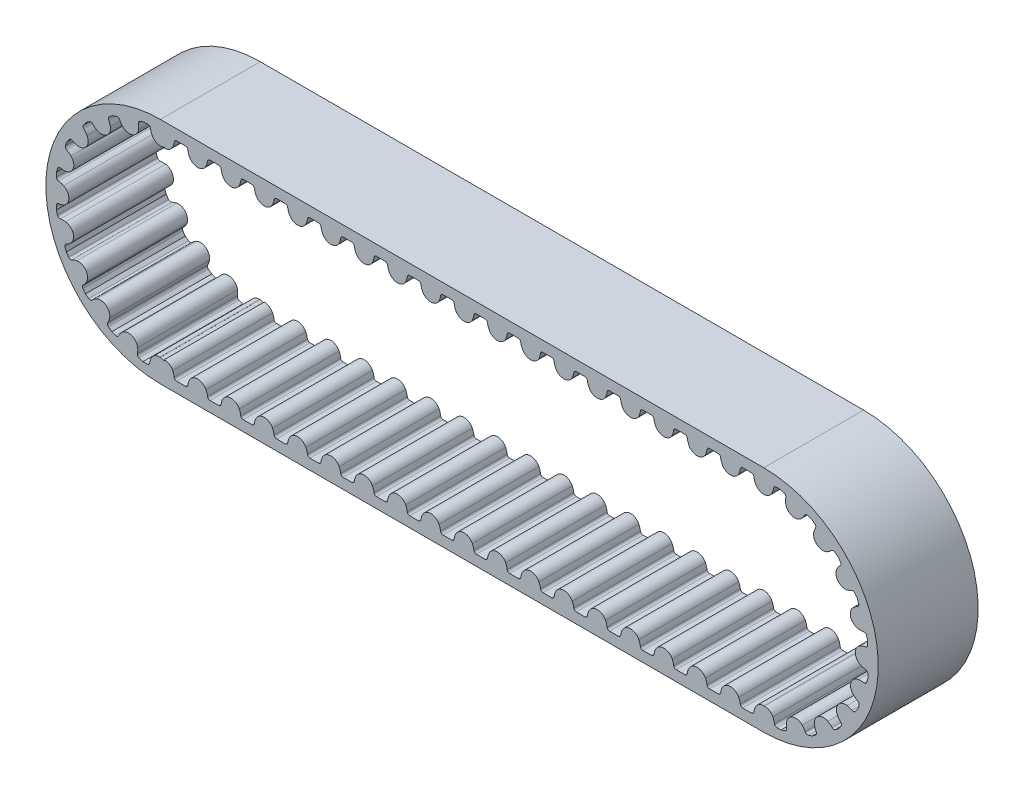
from build123d import *

# Parameters (mm, degrees)
EXTRUDE_THIN1_DEPTH   = 6
BOSS_EXTRUDE1_DEPTH   = 6
LPATTERN1_COUNT       = 18
LPATTERN1_PITCH       = 2
MIRROR1_COPY_1_DEPTH  = 6
MIRROR1_COPY_2_DEPTH  = 6
MIRROR1_COPY_3_DEPTH  = 6
MIRROR1_COPY_4_DEPTH  = 6
MIRROR1_COPY_5_DEPTH  = 6
MIRROR1_COPY_6_DEPTH  = 6
MIRROR1_COPY_7_DEPTH  = 6
MIRROR1_COPY_8_DEPTH  = 6
MIRROR1_COPY_9_DEPTH  = 6
MIRROR1_COPY_10_DEPTH = 6
MIRROR1_COPY_11_DEPTH = 6
MIRROR1_COPY_12_DEPTH = 6
MIRROR1_COPY_13_DEPTH = 6
MIRROR1_COPY_14_DEPTH = 6
MIRROR1_COPY_15_DEPTH = 6
MIRROR1_COPY_16_DEPTH = 6
MIRROR1_COPY_17_DEPTH = 6
BOSS_EXTRUDE2_DEPTH   = 6
MIRROR2_START         = 6
MIRROR2_DEPTH         = 6
CUT_EXTRUDE1_DEPTH    = 29.577285889
SKETCH5_W             = 6
SKETCH5_H             = 13.76
CUT_EXTRUDE2_DEPTH    = 30
BOSS_EXTRUDE3_START   = -6
BOSS_EXTRUDE3_DEPTH   = 6


# Read off the part's stored shape, not the designer's step: Boss-Extrude2, Mirror2
with BuildPart() as part:
    # Sketch1 → Extrude-Thin1 (new body)
    with BuildSketch(Plane.XY):
        with BuildLine():
            Line((18.12, -6.88), (-18.12, -6.88))
            ThreePointArc((-18.12, -6.88), (-25, 0), (-18.12, 6.88))
            Line((-18.12, 6.88), (18.12, 6.88))
            ThreePointArc((18.12, 6.88), (25, 0), (18.12, -6.88))
        make_face()
        with BuildLine():
            Line((18.12, -5.5), (-18.12, -5.5))
            ThreePointArc((-18.12, -5.5), (-23.62, 0), (-18.12, 5.5))
            Line((-18.12, 5.5), (18.12, 5.5))
            ThreePointArc((18.12, 5.5), (23.62, 0), (18.12, -5.5))
        make_face(mode=Mode.SUBTRACT)
    extrude(amount=EXTRUDE_THIN1_DEPTH)

    # Sketch2 → Boss-Extrude1 (add)
    with BuildSketch(Plane.XY.offset(6)):
        with BuildLine():
            Line((17.379824575, 6.25), (16.860175425, 6.25))
            ThreePointArc((16.860175425, 6.25), (16.761268354, 6.212771412), (16.711456891, 6.119565217))
            ThreePointArc((16.711456891, 6.119565217), (16.677611714, 5.961937846), (16.618876404, 5.811797753))
            ThreePointArc((16.618876404, 5.811797753), (16.414149412, 5.584360941), (16.12, 5.5))
            Line((16.12, 5.5), (16.12, 6.88))
            Line((16.12, 6.88), (18.12, 6.88))
            Line((18.12, 6.88), (18.12, 5.5))
            ThreePointArc((18.12, 5.5), (17.825850588, 5.584360941), (17.621123596, 5.811797753))
            ThreePointArc((17.621123596, 5.811797753), (17.562388286, 5.961937846), (17.528543109, 6.119565217))
            ThreePointArc((17.528543109, 6.119565217), (17.478731646, 6.212771412), (17.379824575, 6.25))
        make_face()
    boss_extrude1 = extrude(amount=BOSS_EXTRUDE1_DEPTH)

    # LPattern1: Boss-Extrude1 ×18
    with Locations(*[(-i * LPATTERN1_PITCH, 0, 0) for i in range(1, LPATTERN1_COUNT)]):
        add(boss_extrude1)

    # Mirror1: Boss-Extrude1 across plane
    add(boss_extrude1.mirror(Plane.ZX))

    # Mirror1 copy 1 sketch → Mirror1 copy 1 (add)
    with BuildSketch(Plane(origin=(-2, 0, 6), x_dir=(1, 0, 0), z_dir=(0, 0, 1))):
        with BuildLine():
            Line((17.379824575, -6.25), (16.860175425, -6.25))
            ThreePointArc((16.860175425, -6.25), (16.761268354, -6.212771412), (16.711456891, -6.119565217))
            ThreePointArc((16.711456891, -6.119565217), (16.677611714, -5.961937846), (16.618876404, -5.811797753))
            ThreePointArc((16.618876404, -5.811797753), (16.414149412, -5.584360941), (16.12, -5.5))
            Line((16.12, -5.5), (16.12, -6.88))
            Line((16.12, -6.88), (18.12, -6.88))
            Line((18.12, -6.88), (18.12, -5.5))
            ThreePointArc((18.12, -5.5), (17.825850588, -5.584360941), (17.621123596, -5.811797753))
            ThreePointArc((17.621123596, -5.811797753), (17.562388286, -5.961937846), (17.528543109, -6.119565217))
            ThreePointArc((17.528543109, -6.119565217), (17.478731646, -6.212771412), (17.379824575, -6.25))
        make_face()
    extrude(amount=MIRROR1_COPY_1_DEPTH)

    # Mirror1 copy 2 sketch → Mirror1 copy 2 (add)
    with BuildSketch(Plane(origin=(-4, 0, 6), x_dir=(1, 0, 0), z_dir=(0, 0, 1))):
        with BuildLine():
            Line((17.379824575, -6.25), (16.860175425, -6.25))
            ThreePointArc((16.860175425, -6.25), (16.761268354, -6.212771412), (16.711456891, -6.119565217))
            ThreePointArc((16.711456891, -6.119565217), (16.677611714, -5.961937846), (16.618876404, -5.811797753))
            ThreePointArc((16.618876404, -5.811797753), (16.414149412, -5.584360941), (16.12, -5.5))
            Line((16.12, -5.5), (16.12, -6.88))
            Line((16.12, -6.88), (18.12, -6.88))
            Line((18.12, -6.88), (18.12, -5.5))
            ThreePointArc((18.12, -5.5), (17.825850588, -5.584360941), (17.621123596, -5.811797753))
            ThreePointArc((17.621123596, -5.811797753), (17.562388286, -5.961937846), (17.528543109, -6.119565217))
            ThreePointArc((17.528543109, -6.119565217), (17.478731646, -6.212771412), (17.379824575, -6.25))
        make_face()
    extrude(amount=MIRROR1_COPY_2_DEPTH)

    # Mirror1 copy 3 sketch → Mirror1 copy 3 (add)
    with BuildSketch(Plane(origin=(-6, 0, 6), x_dir=(1, 0, 0), z_dir=(0, 0, 1))):
        with BuildLine():
            Line((17.379824575, -6.25), (16.860175425, -6.25))
            ThreePointArc((16.860175425, -6.25), (16.761268354, -6.212771412), (16.711456891, -6.119565217))
            ThreePointArc((16.711456891, -6.119565217), (16.677611714, -5.961937846), (16.618876404, -5.811797753))
            ThreePointArc((16.618876404, -5.811797753), (16.414149412, -5.584360941), (16.12, -5.5))
            Line((16.12, -5.5), (16.12, -6.88))
            Line((16.12, -6.88), (18.12, -6.88))
            Line((18.12, -6.88), (18.12, -5.5))
            ThreePointArc((18.12, -5.5), (17.825850588, -5.584360941), (17.621123596, -5.811797753))
            ThreePointArc((17.621123596, -5.811797753), (17.562388286, -5.961937846), (17.528543109, -6.119565217))
            ThreePointArc((17.528543109, -6.119565217), (17.478731646, -6.212771412), (17.379824575, -6.25))
        make_face()
    extrude(amount=MIRROR1_COPY_3_DEPTH)

    # Mirror1 copy 4 sketch → Mirror1 copy 4 (add)
    with BuildSketch(Plane(origin=(-8, 0, 6), x_dir=(1, 0, 0), z_dir=(0, 0, 1))):
        with BuildLine():
            Line((17.379824575, -6.25), (16.860175425, -6.25))
            ThreePointArc((16.860175425, -6.25), (16.761268354, -6.212771412), (16.711456891, -6.119565217))
            ThreePointArc((16.711456891, -6.119565217), (16.677611714, -5.961937846), (16.618876404, -5.811797753))
            ThreePointArc((16.618876404, -5.811797753), (16.414149412, -5.584360941), (16.12, -5.5))
            Line((16.12, -5.5), (16.12, -6.88))
            Line((16.12, -6.88), (18.12, -6.88))
            Line((18.12, -6.88), (18.12, -5.5))
            ThreePointArc((18.12, -5.5), (17.825850588, -5.584360941), (17.621123596, -5.811797753))
            ThreePointArc((17.621123596, -5.811797753), (17.562388286, -5.961937846), (17.528543109, -6.119565217))
            ThreePointArc((17.528543109, -6.119565217), (17.478731646, -6.212771412), (17.379824575, -6.25))
        make_face()
    extrude(amount=MIRROR1_COPY_4_DEPTH)

    # Mirror1 copy 5 sketch → Mirror1 copy 5 (add)
    with BuildSketch(Plane(origin=(-10, 0, 6), x_dir=(1, 0, 0), z_dir=(0, 0, 1))):
        with BuildLine():
            Line((17.379824575, -6.25), (16.860175425, -6.25))
            ThreePointArc((16.860175425, -6.25), (16.761268354, -6.212771412), (16.711456891, -6.119565217))
            ThreePointArc((16.711456891, -6.119565217), (16.677611714, -5.961937846), (16.618876404, -5.811797753))
            ThreePointArc((16.618876404, -5.811797753), (16.414149412, -5.584360941), (16.12, -5.5))
            Line((16.12, -5.5), (16.12, -6.88))
            Line((16.12, -6.88), (18.12, -6.88))
            Line((18.12, -6.88), (18.12, -5.5))
            ThreePointArc((18.12, -5.5), (17.825850588, -5.584360941), (17.621123596, -5.811797753))
            ThreePointArc((17.621123596, -5.811797753), (17.562388286, -5.961937846), (17.528543109, -6.119565217))
            ThreePointArc((17.528543109, -6.119565217), (17.478731646, -6.212771412), (17.379824575, -6.25))
        make_face()
    extrude(amount=MIRROR1_COPY_5_DEPTH)

    # Mirror1 copy 6 sketch → Mirror1 copy 6 (add)
    with BuildSketch(Plane(origin=(-12, 0, 6), x_dir=(1, 0, 0), z_dir=(0, 0, 1))):
        with BuildLine():
            Line((17.379824575, -6.25), (16.860175425, -6.25))
            ThreePointArc((16.860175425, -6.25), (16.761268354, -6.212771412), (16.711456891, -6.119565217))
            ThreePointArc((16.711456891, -6.119565217), (16.677611714, -5.961937846), (16.618876404, -5.811797753))
            ThreePointArc((16.618876404, -5.811797753), (16.414149412, -5.584360941), (16.12, -5.5))
            Line((16.12, -5.5), (16.12, -6.88))
            Line((16.12, -6.88), (18.12, -6.88))
            Line((18.12, -6.88), (18.12, -5.5))
            ThreePointArc((18.12, -5.5), (17.825850588, -5.584360941), (17.621123596, -5.811797753))
            ThreePointArc((17.621123596, -5.811797753), (17.562388286, -5.961937846), (17.528543109, -6.119565217))
            ThreePointArc((17.528543109, -6.119565217), (17.478731646, -6.212771412), (17.379824575, -6.25))
        make_face()
    extrude(amount=MIRROR1_COPY_6_DEPTH)

    # Mirror1 copy 7 sketch → Mirror1 copy 7 (add)
    with BuildSketch(Plane(origin=(-14, 0, 6), x_dir=(1, 0, 0), z_dir=(0, 0, 1))):
        with BuildLine():
            Line((17.379824575, -6.25), (16.860175425, -6.25))
            ThreePointArc((16.860175425, -6.25), (16.761268354, -6.212771412), (16.711456891, -6.119565217))
            ThreePointArc((16.711456891, -6.119565217), (16.677611714, -5.961937846), (16.618876404, -5.811797753))
            ThreePointArc((16.618876404, -5.811797753), (16.414149412, -5.584360941), (16.12, -5.5))
            Line((16.12, -5.5), (16.12, -6.88))
            Line((16.12, -6.88), (18.12, -6.88))
            Line((18.12, -6.88), (18.12, -5.5))
            ThreePointArc((18.12, -5.5), (17.825850588, -5.584360941), (17.621123596, -5.811797753))
            ThreePointArc((17.621123596, -5.811797753), (17.562388286, -5.961937846), (17.528543109, -6.119565217))
            ThreePointArc((17.528543109, -6.119565217), (17.478731646, -6.212771412), (17.379824575, -6.25))
        make_face()
    extrude(amount=MIRROR1_COPY_7_DEPTH)

    # Mirror1 copy 8 sketch → Mirror1 copy 8 (add)
    with BuildSketch(Plane(origin=(-16, 0, 6), x_dir=(1, 0, 0), z_dir=(0, 0, 1))):
        with BuildLine():
            Line((17.379824575, -6.25), (16.860175425, -6.25))
            ThreePointArc((16.860175425, -6.25), (16.761268354, -6.212771412), (16.711456891, -6.119565217))
            ThreePointArc((16.711456891, -6.119565217), (16.677611714, -5.961937846), (16.618876404, -5.811797753))
            ThreePointArc((16.618876404, -5.811797753), (16.414149412, -5.584360941), (16.12, -5.5))
            Line((16.12, -5.5), (16.12, -6.88))
            Line((16.12, -6.88), (18.12, -6.88))
            Line((18.12, -6.88), (18.12, -5.5))
            ThreePointArc((18.12, -5.5), (17.825850588, -5.584360941), (17.621123596, -5.811797753))
            ThreePointArc((17.621123596, -5.811797753), (17.562388286, -5.961937846), (17.528543109, -6.119565217))
            ThreePointArc((17.528543109, -6.119565217), (17.478731646, -6.212771412), (17.379824575, -6.25))
        make_face()
    extrude(amount=MIRROR1_COPY_8_DEPTH)

    # Mirror1 copy 9 sketch → Mirror1 copy 9 (add)
    with BuildSketch(Plane(origin=(-18, 0, 6), x_dir=(1, 0, 0), z_dir=(0, 0, 1))):
        with BuildLine():
            Line((17.379824575, -6.25), (16.860175425, -6.25))
            ThreePointArc((16.860175425, -6.25), (16.761268354, -6.212771412), (16.711456891, -6.119565217))
            ThreePointArc((16.711456891, -6.119565217), (16.677611714, -5.961937846), (16.618876404, -5.811797753))
            ThreePointArc((16.618876404, -5.811797753), (16.414149412, -5.584360941), (16.12, -5.5))
            Line((16.12, -5.5), (16.12, -6.88))
            Line((16.12, -6.88), (18.12, -6.88))
            Line((18.12, -6.88), (18.12, -5.5))
            ThreePointArc((18.12, -5.5), (17.825850588, -5.584360941), (17.621123596, -5.811797753))
            ThreePointArc((17.621123596, -5.811797753), (17.562388286, -5.961937846), (17.528543109, -6.119565217))
            ThreePointArc((17.528543109, -6.119565217), (17.478731646, -6.212771412), (17.379824575, -6.25))
        make_face()
    extrude(amount=MIRROR1_COPY_9_DEPTH)

    # Mirror1 copy 10 sketch → Mirror1 copy 10 (add)
    with BuildSketch(Plane(origin=(-20, 0, 6), x_dir=(1, 0, 0), z_dir=(0, 0, 1))):
        with BuildLine():
            Line((17.379824575, -6.25), (16.860175425, -6.25))
            ThreePointArc((16.860175425, -6.25), (16.761268354, -6.212771412), (16.711456891, -6.119565217))
            ThreePointArc((16.711456891, -6.119565217), (16.677611714, -5.961937846), (16.618876404, -5.811797753))
            ThreePointArc((16.618876404, -5.811797753), (16.414149412, -5.584360941), (16.12, -5.5))
            Line((16.12, -5.5), (16.12, -6.88))
            Line((16.12, -6.88), (18.12, -6.88))
            Line((18.12, -6.88), (18.12, -5.5))
            ThreePointArc((18.12, -5.5), (17.825850588, -5.584360941), (17.621123596, -5.811797753))
            ThreePointArc((17.621123596, -5.811797753), (17.562388286, -5.961937846), (17.528543109, -6.119565217))
            ThreePointArc((17.528543109, -6.119565217), (17.478731646, -6.212771412), (17.379824575, -6.25))
        make_face()
    extrude(amount=MIRROR1_COPY_10_DEPTH)

    # Mirror1 copy 11 sketch → Mirror1 copy 11 (add)
    with BuildSketch(Plane(origin=(-22, 0, 6), x_dir=(1, 0, 0), z_dir=(0, 0, 1))):
        with BuildLine():
            Line((17.379824575, -6.25), (16.860175425, -6.25))
            ThreePointArc((16.860175425, -6.25), (16.761268354, -6.212771412), (16.711456891, -6.119565217))
            ThreePointArc((16.711456891, -6.119565217), (16.677611714, -5.961937846), (16.618876404, -5.811797753))
            ThreePointArc((16.618876404, -5.811797753), (16.414149412, -5.584360941), (16.12, -5.5))
            Line((16.12, -5.5), (16.12, -6.88))
            Line((16.12, -6.88), (18.12, -6.88))
            Line((18.12, -6.88), (18.12, -5.5))
            ThreePointArc((18.12, -5.5), (17.825850588, -5.584360941), (17.621123596, -5.811797753))
            ThreePointArc((17.621123596, -5.811797753), (17.562388286, -5.961937846), (17.528543109, -6.119565217))
            ThreePointArc((17.528543109, -6.119565217), (17.478731646, -6.212771412), (17.379824575, -6.25))
        make_face()
    extrude(amount=MIRROR1_COPY_11_DEPTH)

    # Mirror1 copy 12 sketch → Mirror1 copy 12 (add)
    with BuildSketch(Plane(origin=(-24, 0, 6), x_dir=(1, 0, 0), z_dir=(0, 0, 1))):
        with BuildLine():
            Line((17.379824575, -6.25), (16.860175425, -6.25))
            ThreePointArc((16.860175425, -6.25), (16.761268354, -6.212771412), (16.711456891, -6.119565217))
            ThreePointArc((16.711456891, -6.119565217), (16.677611714, -5.961937846), (16.618876404, -5.811797753))
            ThreePointArc((16.618876404, -5.811797753), (16.414149412, -5.584360941), (16.12, -5.5))
            Line((16.12, -5.5), (16.12, -6.88))
            Line((16.12, -6.88), (18.12, -6.88))
            Line((18.12, -6.88), (18.12, -5.5))
            ThreePointArc((18.12, -5.5), (17.825850588, -5.584360941), (17.621123596, -5.811797753))
            ThreePointArc((17.621123596, -5.811797753), (17.562388286, -5.961937846), (17.528543109, -6.119565217))
            ThreePointArc((17.528543109, -6.119565217), (17.478731646, -6.212771412), (17.379824575, -6.25))
        make_face()
    extrude(amount=MIRROR1_COPY_12_DEPTH)

    # Mirror1 copy 13 sketch → Mirror1 copy 13 (add)
    with BuildSketch(Plane(origin=(-26, 0, 6), x_dir=(1, 0, 0), z_dir=(0, 0, 1))):
        with BuildLine():
            Line((17.379824575, -6.25), (16.860175425, -6.25))
            ThreePointArc((16.860175425, -6.25), (16.761268354, -6.212771412), (16.711456891, -6.119565217))
            ThreePointArc((16.711456891, -6.119565217), (16.677611714, -5.961937846), (16.618876404, -5.811797753))
            ThreePointArc((16.618876404, -5.811797753), (16.414149412, -5.584360941), (16.12, -5.5))
            Line((16.12, -5.5), (16.12, -6.88))
            Line((16.12, -6.88), (18.12, -6.88))
            Line((18.12, -6.88), (18.12, -5.5))
            ThreePointArc((18.12, -5.5), (17.825850588, -5.584360941), (17.621123596, -5.811797753))
            ThreePointArc((17.621123596, -5.811797753), (17.562388286, -5.961937846), (17.528543109, -6.119565217))
            ThreePointArc((17.528543109, -6.119565217), (17.478731646, -6.212771412), (17.379824575, -6.25))
        make_face()
    extrude(amount=MIRROR1_COPY_13_DEPTH)

    # Mirror1 copy 14 sketch → Mirror1 copy 14 (add)
    with BuildSketch(Plane(origin=(-28, 0, 6), x_dir=(1, 0, 0), z_dir=(0, 0, 1))):
        with BuildLine():
            Line((17.379824575, -6.25), (16.860175425, -6.25))
            ThreePointArc((16.860175425, -6.25), (16.761268354, -6.212771412), (16.711456891, -6.119565217))
            ThreePointArc((16.711456891, -6.119565217), (16.677611714, -5.961937846), (16.618876404, -5.811797753))
            ThreePointArc((16.618876404, -5.811797753), (16.414149412, -5.584360941), (16.12, -5.5))
            Line((16.12, -5.5), (16.12, -6.88))
            Line((16.12, -6.88), (18.12, -6.88))
            Line((18.12, -6.88), (18.12, -5.5))
            ThreePointArc((18.12, -5.5), (17.825850588, -5.584360941), (17.621123596, -5.811797753))
            ThreePointArc((17.621123596, -5.811797753), (17.562388286, -5.961937846), (17.528543109, -6.119565217))
            ThreePointArc((17.528543109, -6.119565217), (17.478731646, -6.212771412), (17.379824575, -6.25))
        make_face()
    extrude(amount=MIRROR1_COPY_14_DEPTH)

    # Mirror1 copy 15 sketch → Mirror1 copy 15 (add)
    with BuildSketch(Plane(origin=(-30, 0, 6), x_dir=(1, 0, 0), z_dir=(0, 0, 1))):
        with BuildLine():
            Line((17.379824575, -6.25), (16.860175425, -6.25))
            ThreePointArc((16.860175425, -6.25), (16.761268354, -6.212771412), (16.711456891, -6.119565217))
            ThreePointArc((16.711456891, -6.119565217), (16.677611714, -5.961937846), (16.618876404, -5.811797753))
            ThreePointArc((16.618876404, -5.811797753), (16.414149412, -5.584360941), (16.12, -5.5))
            Line((16.12, -5.5), (16.12, -6.88))
            Line((16.12, -6.88), (18.12, -6.88))
            Line((18.12, -6.88), (18.12, -5.5))
            ThreePointArc((18.12, -5.5), (17.825850588, -5.584360941), (17.621123596, -5.811797753))
            ThreePointArc((17.621123596, -5.811797753), (17.562388286, -5.961937846), (17.528543109, -6.119565217))
            ThreePointArc((17.528543109, -6.119565217), (17.478731646, -6.212771412), (17.379824575, -6.25))
        make_face()
    extrude(amount=MIRROR1_COPY_15_DEPTH)

    # Mirror1 copy 16 sketch → Mirror1 copy 16 (add)
    with BuildSketch(Plane(origin=(-32, 0, 6), x_dir=(1, 0, 0), z_dir=(0, 0, 1))):
        with BuildLine():
            Line((17.379824575, -6.25), (16.860175425, -6.25))
            ThreePointArc((16.860175425, -6.25), (16.761268354, -6.212771412), (16.711456891, -6.119565217))
            ThreePointArc((16.711456891, -6.119565217), (16.677611714, -5.961937846), (16.618876404, -5.811797753))
            ThreePointArc((16.618876404, -5.811797753), (16.414149412, -5.584360941), (16.12, -5.5))
            Line((16.12, -5.5), (16.12, -6.88))
            Line((16.12, -6.88), (18.12, -6.88))
            Line((18.12, -6.88), (18.12, -5.5))
            ThreePointArc((18.12, -5.5), (17.825850588, -5.584360941), (17.621123596, -5.811797753))
            ThreePointArc((17.621123596, -5.811797753), (17.562388286, -5.961937846), (17.528543109, -6.119565217))
            ThreePointArc((17.528543109, -6.119565217), (17.478731646, -6.212771412), (17.379824575, -6.25))
        make_face()
    extrude(amount=MIRROR1_COPY_16_DEPTH)

    # Mirror1 copy 17 sketch → Mirror1 copy 17 (add)
    with BuildSketch(Plane(origin=(-34, 0, 6), x_dir=(1, 0, 0), z_dir=(0, 0, 1))):
        with BuildLine():
            Line((17.379824575, -6.25), (16.860175425, -6.25))
            ThreePointArc((16.860175425, -6.25), (16.761268354, -6.212771412), (16.711456891, -6.119565217))
            ThreePointArc((16.711456891, -6.119565217), (16.677611714, -5.961937846), (16.618876404, -5.811797753))
            ThreePointArc((16.618876404, -5.811797753), (16.414149412, -5.584360941), (16.12, -5.5))
            Line((16.12, -5.5), (16.12, -6.88))
            Line((16.12, -6.88), (18.12, -6.88))
            Line((18.12, -6.88), (18.12, -5.5))
            ThreePointArc((18.12, -5.5), (17.825850588, -5.584360941), (17.621123596, -5.811797753))
            ThreePointArc((17.621123596, -5.811797753), (17.562388286, -5.961937846), (17.528543109, -6.119565217))
            ThreePointArc((17.528543109, -6.119565217), (17.478731646, -6.212771412), (17.379824575, -6.25))
        make_face()
    extrude(amount=MIRROR1_COPY_17_DEPTH)

    # Boss-Extrude2 outline → Boss-Extrude2 (add)
    with BuildSketch(Plane.XY.offset(6)):
        with BuildLine():
            ThreePointArc((21.169210972, 6.167391057), (20.240406668, 6.545095535), (19.266566921, 6.783788344))
            Line((19.266566921, 6.783788344), (19.12, 6.331377723))
            Line((19.12, 6.331377723), (19.12, 6.88))
            Line((19.12, 6.88), (18.12, 6.88))
            Line((18.12, 6.88), (18.12, 5.5))
            ThreePointArc((18.12, 5.5), (18.414149412, 5.584360941), (18.618876404, 5.811797753))
            ThreePointArc((18.618876404, 5.811797753), (18.677611714, 5.961937846), (18.711456891, 6.119565217))
            ThreePointArc((18.711456891, 6.119565217), (18.761268354, 6.212771412), (18.860175425, 6.25))
            Line((18.860175425, 6.25), (19.107146917, 6.25))
            Line((19.107146917, 6.25), (19.342096337, 6.173883721))
            ThreePointArc((19.342096337, 6.173883721), (19.424715012, 6.10798432), (19.443375731, 6.003963389))
            ThreePointArc((19.443375731, 6.003963389), (19.426992851, 5.843577961), (19.436596072, 5.682644241))
            ThreePointArc((19.436596072, 5.682644241), (19.815092539, 5.23227114), (20.385780295, 5.375138179))
            ThreePointArc((20.385780295, 5.375138179), (20.487929462, 5.499867614), (20.568707667, 5.639390966))
            ThreePointArc((20.568707667, 5.639390966), (20.644820431, 5.712708246), (20.750386706, 5.717641597))
            Line((20.750386706, 5.717641597), (20.985336126, 5.641525318))
            Line((20.985336126, 5.641525318), (21.185389751, 5.496703133))
            ThreePointArc((21.185389751, 5.496703133), (21.24367661, 5.408548618), (21.229369853, 5.303840007))
            ThreePointArc((21.229369853, 5.303840007), (21.164353887, 5.156310998), (21.123890088, 5.000251506))
            ThreePointArc((21.123890088, 5.000251506), (21.345157735, 4.455149558), (21.932096995, 4.415176926))
            ThreePointArc((21.932096995, 4.415176926), (22.06771519, 4.50235255), (22.187562183, 4.610188455))
            ThreePointArc((22.187562183, 4.610188455), (22.282566218, 4.656478948), (22.384514193, 4.628636771))
            Line((22.384514193, 4.628636771), (22.584567818, 4.483814586))
            Line((22.584567818, 4.483814586), (22.730249236, 4.284385795))
            ThreePointArc((22.730249236, 4.284385795), (22.758529706, 4.182558533), (22.712648322, 4.087356248))
            ThreePointArc((22.712648322, 4.087356248), (22.605328961, 3.967046485), (22.518737534, 3.83105454))
            ThreePointArc((22.518737534, 3.83105454), (22.561234639, 3.244292662), (23.107283374, 3.025371934))
            ThreePointArc((23.107283374, 3.025371934), (23.263167359, 3.066506681), (23.410415323, 3.132156672))
            ThreePointArc((23.410415323, 3.132156672), (23.515061421, 3.146913723), (23.603465854, 3.089006618))
            Line((23.603465854, 3.089006618), (23.749147272, 2.889577828))
            Line((23.749147272, 2.889577828), (23.826273531, 2.654958012))
            ThreePointArc((23.826273531, 2.654958012), (23.821794342, 2.549371492), (23.748805155, 2.472944042))
            ThreePointArc((23.748805155, 2.472944042), (23.609630578, 2.391566396), (23.485341713, 2.288881624))
            ThreePointArc((23.485341713, 2.288881624), (23.34493093, 1.717584575), (23.796928047, 1.341028985))
            ThreePointArc((23.796928047, 1.341028985), (23.957901589, 1.332118144), (24.118215058, 1.349190803))
            ThreePointArc((24.118215058, 1.349190803), (24.222315299, 1.330977725), (24.288569492, 1.248643295))
            Line((24.288569492, 1.248643295), (24.365695751, 1.014023479))
            Line((24.365695751, 1.014023479), (24.366758151, 0.767054272))
            ThreePointArc((24.366758151, 0.767054272), (24.329955377, 0.66798797), (24.23696432, 0.617776022))
            ThreePointArc((24.23696432, 0.617776022), (24.079483999, 0.58325309), (23.929597957, 0.523872465))
            ThreePointArc((23.929597957, 0.523872465), (23.619949112, 0.023659412), (23.933890002, -0.473871113))
            ThreePointArc((23.933890002, -0.473871113), (24.084281368, -0.53196002), (24.242052873, -0.565126816))
            ThreePointArc((24.242052873, -0.565126816), (24.33547248, -0.614536872), (24.373126193, -0.713282881))
            Line((24.373126193, -0.713282881), (24.374188594, -0.960252088))
            Line((24.374188594, -0.960252088), (24.299083704, -1.195526764))
            ThreePointArc((24.299083704, -1.195526764), (24.233540314, -1.278428155), (24.129600618, -1.297536169))
            ThreePointArc((24.129600618, -1.297536169), (23.9691462, -1.281843373), (23.808255279, -1.292138795))
            ThreePointArc((23.808255279, -1.292138795), (23.359514528, -1.672569136), (23.504835178, -2.242637039))
            ThreePointArc((23.504835178, -2.242637039), (23.630002876, -2.34424871), (23.769872422, -2.424425978))
            ThreePointArc((23.769872422, -2.424425978), (23.843516439, -2.500222648), (23.84890386, -2.605766725))
            Line((23.84890386, -2.605766725), (23.77379897, -2.841041402))
            Line((23.77379897, -2.841041402), (23.629838697, -3.041716158))
            ThreePointArc((23.629838697, -3.041716158), (23.541935731, -3.100381693), (23.437166545, -3.086525495))
            ThreePointArc((23.437166545, -3.086525495), (23.289359222, -3.022144758), (23.13312711, -2.982352657))
            ThreePointArc((23.13312711, -2.982352657), (22.588982034, -3.205963127), (22.551534616, -3.793068907))
            ThreePointArc((22.551534616, -3.793068907), (22.639292823, -3.928310843), (22.747643278, -4.047692848))
            ThreePointArc((22.747643278, -4.047692848), (22.794342023, -4.142496876), (22.766938653, -4.244563677))
            Line((22.766938653, -4.244563677), (22.622978381, -4.445238434))
            Line((22.622978381, -4.445238434), (22.424178116, -4.591776389))
            ThreePointArc((22.424178116, -4.591776389), (22.322473449, -4.62049463), (22.227074677, -4.575023202))
            ThreePointArc((22.227074677, -4.575023202), (22.10630437, -4.468222373), (21.969941193, -4.382216745))
            ThreePointArc((21.969941193, -4.382216745), (21.383367554, -4.427237537), (21.166797795, -4.974222953))
            ThreePointArc((21.166797795, -4.974222953), (21.208602729, -5.129928546), (21.274885531, -5.27689274))
            ThreePointArc((21.274885531, -5.27689274), (21.290092603, -5.38147439), (21.232566325, -5.470127104))
            Line((21.232566325, -5.470127104), (21.033766059, -5.616665059))
            Line((21.033766059, -5.616665059), (20.799480189, -5.694799872))
            ThreePointArc((20.799480189, -5.694799872), (20.693875377, -5.690774926), (20.617134656, -5.618115183))
            ThreePointArc((20.617134656, -5.618115183), (20.535159074, -5.479291957), (20.431940597, -5.355445963))
            ThreePointArc((20.431940597, -5.355445963), (19.860044828, -5.217494034), (19.485437083, -5.671106802))
            ThreePointArc((19.485437083, -5.671106802), (19.477218786, -5.832117186), (19.49498091, -5.992355731))
            ThreePointArc((19.49498091, -5.992355731), (19.477215809, -6.096533356), (19.395167147, -6.163141115))
            Line((19.395167147, -6.163141115), (19.160881277, -6.241275927))
            Line((19.160881277, -6.241275927), (18.913918925, -6.243400708))
            ThreePointArc((18.913918925, -6.243400708), (18.814695224, -6.207024429), (18.76408372, -6.114250229))
            ThreePointArc((18.76408372, -6.114250229), (18.728883674, -5.956919873), (18.668858831, -5.807290657))
            ThreePointArc((18.668858831, -5.807290657), (18.462182698, -5.581623599), (18.167318386, -5.499796448))
            ThreePointArc((18.167318386, -5.499796448), (18.143659412, -5.499949112), (18.12, -5.5))
            Line((18.12, -5.5), (18.12, -6.88))
            Line((18.12, -6.88), (17.17915618, -6.88))
            Line((17.17915618, -6.88), (17.179228009, -6.888348718))
            Line((17.179228009, -6.888348718), (18.179191, -6.879745375))
            ThreePointArc((18.179191, -6.879745375), (19.74326665, -6.685761392), (21.222158303, -6.140929397))
            Line((21.222158303, -6.140929397), (21.071704563, -5.689796485))
            Line((21.071704563, -5.689796485), (21.353873071, -6.072599523))
            ThreePointArc((21.353873071, -6.072599523), (22.20217614, -5.538071683), (22.96377763, -4.885920412))
            Line((22.96377763, -4.885920412), (22.681609121, -4.503117375))
            Line((22.681609121, -4.503117375), (23.068021615, -4.780322384))
            ThreePointArc((23.068021615, -4.780322384), (23.710290254, -4.010368422), (24.233826389, -3.155238008))
            Line((24.233826389, -3.155238008), (23.847413895, -2.878032999))
            Line((23.847413895, -2.878032999), (24.300450819, -3.022652423))
            ThreePointArc((24.300450819, -3.022652423), (24.674156355, -2.092231937), (24.908657778, -1.117374413))
            Line((24.908657778, -1.117374413), (24.455620854, -0.972754989))
            Line((24.455620854, -0.972754989), (25.004238055, -0.970394974))
            Line((25.004238055, -0.970394974), (24.995634632, 1.029586521))
            Line((24.995634632, 1.029586521), (24.447017431, 1.027226507))
            Line((24.447017431, 1.027226507), (24.898793378, 1.175738211))
            ThreePointArc((24.898793378, 1.175738211), (24.6559136, 2.14854216), (24.274217169, 3.075713095))
            Line((24.274217169, 3.075713095), (23.822441222, 2.92720139))
            Line((23.822441222, 2.92720139), (24.206454525, 3.20772058))
            ThreePointArc((24.206454525, 3.20772058), (23.675580785, 4.058315184), (23.026711739, 4.822714994))
            Line((23.026711739, 4.822714994), (22.642698436, 4.542195805))
            Line((22.642698436, 4.542195805), (22.921563115, 4.927412267))
            ThreePointArc((22.921563115, 4.927412267), (22.154379131, 5.572987083), (21.30150873, 6.100196898))
            Line((21.30150873, 6.100196898), (21.022644051, 5.714980436))
            Line((21.022644051, 5.714980436), (21.169210972, 6.167391057))
        make_face()
    extrude(amount=BOSS_EXTRUDE2_DEPTH)

    # Mirror2 outline → Mirror2 (add)
    with BuildSketch(Plane.XY.offset(MIRROR2_START)):
        with BuildLine():
            Line((-17.17915618, -6.88), (-17.88, -6.88))
            Line((-17.88, -6.88), (-17.88, -5.582857972))
            ThreePointArc((-17.88, -5.582857972), (-17.995340707, -5.528673692), (-18.12, -5.502226096))
            Line((-18.12, -5.502226096), (-18.12, -5.5))
            ThreePointArc((-18.12, -5.5), (-18.143659412, -5.499949112), (-18.167318386, -5.499796448))
            ThreePointArc((-18.167318386, -5.499796448), (-18.462182698, -5.581623599), (-18.668858831, -5.807290657))
            ThreePointArc((-18.668858831, -5.807290657), (-18.728883674, -5.956919873), (-18.76408372, -6.114250229))
            ThreePointArc((-18.76408372, -6.114250229), (-18.814695224, -6.207024429), (-18.913918925, -6.243400708))
            Line((-18.913918925, -6.243400708), (-19.160881277, -6.241275927))
            Line((-19.160881277, -6.241275927), (-19.395167147, -6.163141115))
            ThreePointArc((-19.395167147, -6.163141115), (-19.477215809, -6.096533356), (-19.49498091, -5.992355731))
            ThreePointArc((-19.49498091, -5.992355731), (-19.477218786, -5.832117186), (-19.485437083, -5.671106802))
            ThreePointArc((-19.485437083, -5.671106802), (-19.860044828, -5.217494034), (-20.431940597, -5.355445963))
            ThreePointArc((-20.431940597, -5.355445963), (-20.535159074, -5.479291957), (-20.617134656, -5.618115183))
            ThreePointArc((-20.617134656, -5.618115183), (-20.693875377, -5.690774926), (-20.799480189, -5.694799872))
            Line((-20.799480189, -5.694799872), (-21.033766059, -5.616665059))
            Line((-21.033766059, -5.616665059), (-21.232566325, -5.470127104))
            ThreePointArc((-21.232566325, -5.470127104), (-21.290092603, -5.38147439), (-21.274885531, -5.27689274))
            ThreePointArc((-21.274885531, -5.27689274), (-21.208602729, -5.129928546), (-21.166797795, -4.974222953))
            ThreePointArc((-21.166797795, -4.974222953), (-21.383367554, -4.427237537), (-21.969941193, -4.382216745))
            ThreePointArc((-21.969941193, -4.382216745), (-22.10630437, -4.468222373), (-22.227074677, -4.575023202))
            ThreePointArc((-22.227074677, -4.575023202), (-22.322473449, -4.62049463), (-22.424178116, -4.591776389))
            Line((-22.424178116, -4.591776389), (-22.622978381, -4.445238434))
            Line((-22.622978381, -4.445238434), (-22.766938653, -4.244563677))
            ThreePointArc((-22.766938653, -4.244563677), (-22.794342023, -4.142496876), (-22.747643278, -4.047692848))
            ThreePointArc((-22.747643278, -4.047692848), (-22.639292823, -3.928310843), (-22.551534616, -3.793068907))
            ThreePointArc((-22.551534616, -3.793068907), (-22.588982034, -3.205963127), (-23.13312711, -2.982352657))
            ThreePointArc((-23.13312711, -2.982352657), (-23.289359222, -3.022144758), (-23.437166545, -3.086525495))
            ThreePointArc((-23.437166545, -3.086525495), (-23.541935731, -3.100381693), (-23.629838697, -3.041716158))
            Line((-23.629838697, -3.041716158), (-23.77379897, -2.841041402))
            Line((-23.77379897, -2.841041402), (-23.84890386, -2.605766725))
            ThreePointArc((-23.84890386, -2.605766725), (-23.843516439, -2.500222648), (-23.769872422, -2.424425978))
            ThreePointArc((-23.769872422, -2.424425978), (-23.630002876, -2.34424871), (-23.504835178, -2.242637039))
            ThreePointArc((-23.504835178, -2.242637039), (-23.359514528, -1.672569136), (-23.808255279, -1.292138795))
            ThreePointArc((-23.808255279, -1.292138795), (-23.9691462, -1.281843373), (-24.129600618, -1.297536169))
            ThreePointArc((-24.129600618, -1.297536169), (-24.233540314, -1.278428155), (-24.299083704, -1.195526764))
            Line((-24.299083704, -1.195526764), (-24.374188594, -0.960252088))
            Line((-24.374188594, -0.960252088), (-24.373126193, -0.713282881))
            ThreePointArc((-24.373126193, -0.713282881), (-24.33547248, -0.614536872), (-24.242052873, -0.565126816))
            ThreePointArc((-24.242052873, -0.565126816), (-24.084281368, -0.53196002), (-23.933890002, -0.473871113))
            ThreePointArc((-23.933890002, -0.473871113), (-23.619949112, 0.023659412), (-23.929597957, 0.523872465))
            ThreePointArc((-23.929597957, 0.523872465), (-24.079483999, 0.58325309), (-24.23696432, 0.617776022))
            ThreePointArc((-24.23696432, 0.617776022), (-24.329955377, 0.66798797), (-24.366758151, 0.767054272))
            Line((-24.366758151, 0.767054272), (-24.365695751, 1.014023479))
            Line((-24.365695751, 1.014023479), (-24.288569492, 1.248643295))
            ThreePointArc((-24.288569492, 1.248643295), (-24.222315299, 1.330977725), (-24.118215058, 1.349190803))
            ThreePointArc((-24.118215058, 1.349190803), (-23.957901589, 1.332118144), (-23.796928047, 1.341028985))
            ThreePointArc((-23.796928047, 1.341028985), (-23.34493093, 1.717584575), (-23.485341713, 2.288881624))
            ThreePointArc((-23.485341713, 2.288881624), (-23.609630578, 2.391566396), (-23.748805155, 2.472944042))
            ThreePointArc((-23.748805155, 2.472944042), (-23.821794342, 2.549371492), (-23.826273531, 2.654958012))
            Line((-23.826273531, 2.654958012), (-23.749147272, 2.889577828))
            Line((-23.749147272, 2.889577828), (-23.603465854, 3.089006618))
            ThreePointArc((-23.603465854, 3.089006618), (-23.515061421, 3.146913723), (-23.410415323, 3.132156672))
            ThreePointArc((-23.410415323, 3.132156672), (-23.263167359, 3.066506681), (-23.107283374, 3.025371934))
            ThreePointArc((-23.107283374, 3.025371934), (-22.561234639, 3.244292662), (-22.518737534, 3.83105454))
            ThreePointArc((-22.518737534, 3.83105454), (-22.605328961, 3.967046485), (-22.712648322, 4.087356248))
            ThreePointArc((-22.712648322, 4.087356248), (-22.758529706, 4.182558533), (-22.730249236, 4.284385795))
            Line((-22.730249236, 4.284385795), (-22.584567818, 4.483814586))
            Line((-22.584567818, 4.483814586), (-22.384514193, 4.628636771))
            ThreePointArc((-22.384514193, 4.628636771), (-22.282566218, 4.656478948), (-22.187562183, 4.610188455))
            ThreePointArc((-22.187562183, 4.610188455), (-22.06771519, 4.50235255), (-21.932096995, 4.415176926))
            ThreePointArc((-21.932096995, 4.415176926), (-21.345157735, 4.455149558), (-21.123890088, 5.000251506))
            ThreePointArc((-21.123890088, 5.000251506), (-21.164353887, 5.156310998), (-21.229369853, 5.303840007))
            ThreePointArc((-21.229369853, 5.303840007), (-21.24367661, 5.408548618), (-21.185389751, 5.496703133))
            Line((-21.185389751, 5.496703133), (-20.985336126, 5.641525318))
            Line((-20.985336126, 5.641525318), (-20.750386706, 5.717641597))
            ThreePointArc((-20.750386706, 5.717641597), (-20.644820431, 5.712708246), (-20.568707667, 5.639390966))
            ThreePointArc((-20.568707667, 5.639390966), (-20.487929462, 5.499867614), (-20.385780295, 5.375138179))
            ThreePointArc((-20.385780295, 5.375138179), (-19.815092539, 5.23227114), (-19.436596072, 5.682644241))
            ThreePointArc((-19.436596072, 5.682644241), (-19.426992851, 5.843577961), (-19.443375731, 6.003963389))
            ThreePointArc((-19.443375731, 6.003963389), (-19.424715012, 6.10798432), (-19.342096337, 6.173883721))
            Line((-19.342096337, 6.173883721), (-19.107146917, 6.25))
            Line((-19.107146917, 6.25), (-18.860175425, 6.25))
            ThreePointArc((-18.860175425, 6.25), (-18.761268354, 6.212771412), (-18.711456891, 6.119565217))
            ThreePointArc((-18.711456891, 6.119565217), (-18.677611714, 5.961937846), (-18.618876404, 5.811797753))
            ThreePointArc((-18.618876404, 5.811797753), (-18.30246948, 5.53085318), (-17.88, 5.55457518))
            Line((-17.88, 5.55457518), (-17.88, 6.88))
            Line((-17.88, 6.88), (-19.12, 6.88))
            Line((-19.12, 6.88), (-19.12, 6.331377723))
            Line((-19.12, 6.331377723), (-19.266566921, 6.783788344))
            ThreePointArc((-19.266566921, 6.783788344), (-20.240406668, 6.545095535), (-21.169210972, 6.167391057))
            Line((-21.169210972, 6.167391057), (-21.022644051, 5.714980436))
            Line((-21.022644051, 5.714980436), (-21.30150873, 6.100196898))
            ThreePointArc((-21.30150873, 6.100196898), (-22.154379131, 5.572987083), (-22.921563115, 4.927412267))
            Line((-22.921563115, 4.927412267), (-22.642698436, 4.542195805))
            Line((-22.642698436, 4.542195805), (-23.026711739, 4.822714994))
            ThreePointArc((-23.026711739, 4.822714994), (-23.675580785, 4.058315184), (-24.206454525, 3.20772058))
            Line((-24.206454525, 3.20772058), (-23.822441222, 2.92720139))
            Line((-23.822441222, 2.92720139), (-24.274217169, 3.075713095))
            ThreePointArc((-24.274217169, 3.075713095), (-24.6559136, 2.14854216), (-24.898793378, 1.175738211))
            Line((-24.898793378, 1.175738211), (-24.447017431, 1.027226507))
            Line((-24.447017431, 1.027226507), (-24.995634632, 1.029586521))
            Line((-24.995634632, 1.029586521), (-25.004238055, -0.970394974))
            Line((-25.004238055, -0.970394974), (-24.455620854, -0.972754989))
            Line((-24.455620854, -0.972754989), (-24.908657778, -1.117374413))
            ThreePointArc((-24.908657778, -1.117374413), (-24.674156355, -2.092231937), (-24.300450819, -3.022652423))
            Line((-24.300450819, -3.022652423), (-23.847413895, -2.878032999))
            Line((-23.847413895, -2.878032999), (-24.233826389, -3.155238008))
            ThreePointArc((-24.233826389, -3.155238008), (-23.710290254, -4.010368422), (-23.068021615, -4.780322384))
            Line((-23.068021615, -4.780322384), (-22.681609121, -4.503117375))
            Line((-22.681609121, -4.503117375), (-22.96377763, -4.885920412))
            ThreePointArc((-22.96377763, -4.885920412), (-22.20217614, -5.538071683), (-21.353873071, -6.072599523))
            Line((-21.353873071, -6.072599523), (-21.071704563, -5.689796485))
            Line((-21.071704563, -5.689796485), (-21.222158303, -6.140929397))
            ThreePointArc((-21.222158303, -6.140929397), (-19.74326665, -6.685761392), (-18.179191, -6.879745375))
            Line((-18.179191, -6.879745375), (-17.179228009, -6.888348718))
            Line((-17.179228009, -6.888348718), (-17.17915618, -6.88))
        make_face()
    extrude(amount=MIRROR2_DEPTH)

    # Sketch4 → Cut-Extrude1 (cut, through all)
    with BuildSketch(Plane(origin=(0, 0, 0), x_dir=(-1, 0, 0), z_dir=(0, 0, -1))):
        with BuildLine():
            Line((18.12, -16.88), (-18.12, -16.88))
            ThreePointArc((-18.12, -16.88), (-35, 0), (-18.12, 16.88))
            Line((-18.12, 16.88), (18.12, 16.88))
            ThreePointArc((18.12, 16.88), (35, 0), (18.12, -16.88))
        make_face()
        with BuildLine():
            Line((-18.12, 6.88), (18.12, 6.88))
            ThreePointArc((18.12, 6.88), (25, 0), (18.12, -6.88))
            Line((18.12, -6.88), (-18.12, -6.88))
            ThreePointArc((-18.12, -6.88), (-25, 0), (-18.12, 6.88))
        make_face(mode=Mode.SUBTRACT)
    extrude(amount=-CUT_EXTRUDE1_DEPTH, mode=Mode.SUBTRACT)

    # Sketch5 → Cut-Extrude2 (cut, symmetric)
    with BuildSketch(Plane(origin=(0, 0, 0), x_dir=(0, 0, -1), z_dir=(1, 0, 0))):
        with Locations((-3, 0)):
            Rectangle(SKETCH5_W, SKETCH5_H)
    extrude(amount=CUT_EXTRUDE2_DEPTH, both=True, mode=Mode.SUBTRACT)

    # Sketch6 → Boss-Extrude3 (add)
    with BuildSketch(Plane.XY.offset(12).offset(BOSS_EXTRUDE3_START)):
        with BuildLine():
            Line((-18.12, 6.88), (-18.12, 6.38))
            ThreePointArc((-18.12, 6.38), (-24.5, 0), (-18.12, -6.38))
            Line((-18.12, -6.38), (-18.12, -6.88))
            ThreePointArc((-18.12, -6.88), (-25, 0), (-18.12, 6.88))
        make_face()
    boss_extrude3 = extrude(amount=BOSS_EXTRUDE3_DEPTH)

    # Mirror3: Boss-Extrude3 across plane
    add(boss_extrude3.mirror(Plane(origin=(0, 0, 0), x_dir=(0, 0, 1), z_dir=(1, 0, 0))))


solid = part.part
